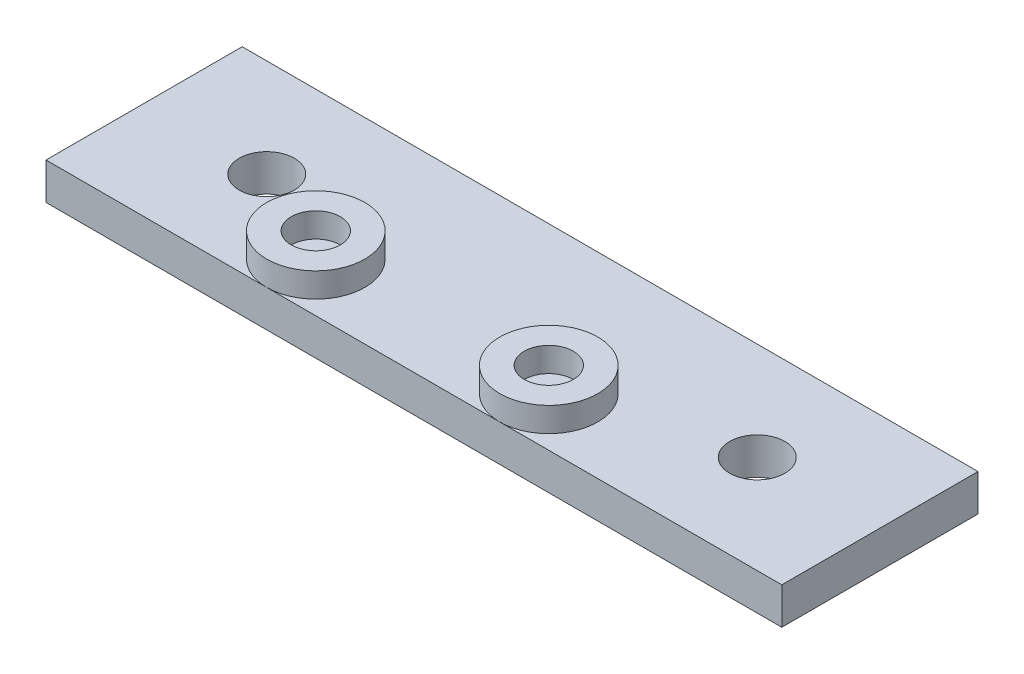
from build123d import *

# Parameters (mm, degrees)
SKETCH1_R             = 4
SKETCH1_R_2           = 2
BOSS_EXTRUDE1_DEPTH   = 2
BOSS_EXTRUDE1_2_DEPTH = 2
SKETCH2_W             = 60
SKETCH2_H             = 16
SKETCH2_R             = 2.25
BOSS_EXTRUDE2_DEPTH   = 3


with BuildPart() as part:
    # Sketch1 → Boss-Extrude1 (new body)
    with BuildSketch(Plane(origin=(0, 0, 0), x_dir=(1, 0, 0), z_dir=(0, 1, 0))):
        Circle(SKETCH1_R)
        Circle(SKETCH1_R_2, mode=Mode.SUBTRACT)
    extrude(amount=BOSS_EXTRUDE1_DEPTH)



with BuildPart() as body_2:
    # Sketch1 → Boss-Extrude1 2 (new body)
    with BuildSketch(Plane(origin=(0, 0, 0), x_dir=(1, 0, 0), z_dir=(0, 1, 0))):
        with Locations((19, 0)):
            Circle(SKETCH1_R)
        with Locations((19, 0)):
            Circle(SKETCH1_R_2, mode=Mode.SUBTRACT)
    extrude(amount=BOSS_EXTRUDE1_2_DEPTH)


with BuildPart() as part_1:
    add(part.part)

    add(body_2.part)  # Boss-Extrude2 merges body 2
    # Sketch2 → Boss-Extrude2 (add)
    with BuildSketch(Plane.XZ):
        with Locations((12, -4)):
            Rectangle(SKETCH2_W, SKETCH2_H)
        with Locations((-8, -4)):
            Circle(SKETCH2_R, mode=Mode.SUBTRACT)
        with Locations((32, -4)):
            Circle(SKETCH2_R, mode=Mode.SUBTRACT)
    extrude(amount=BOSS_EXTRUDE2_DEPTH)


solid = part_1.part
